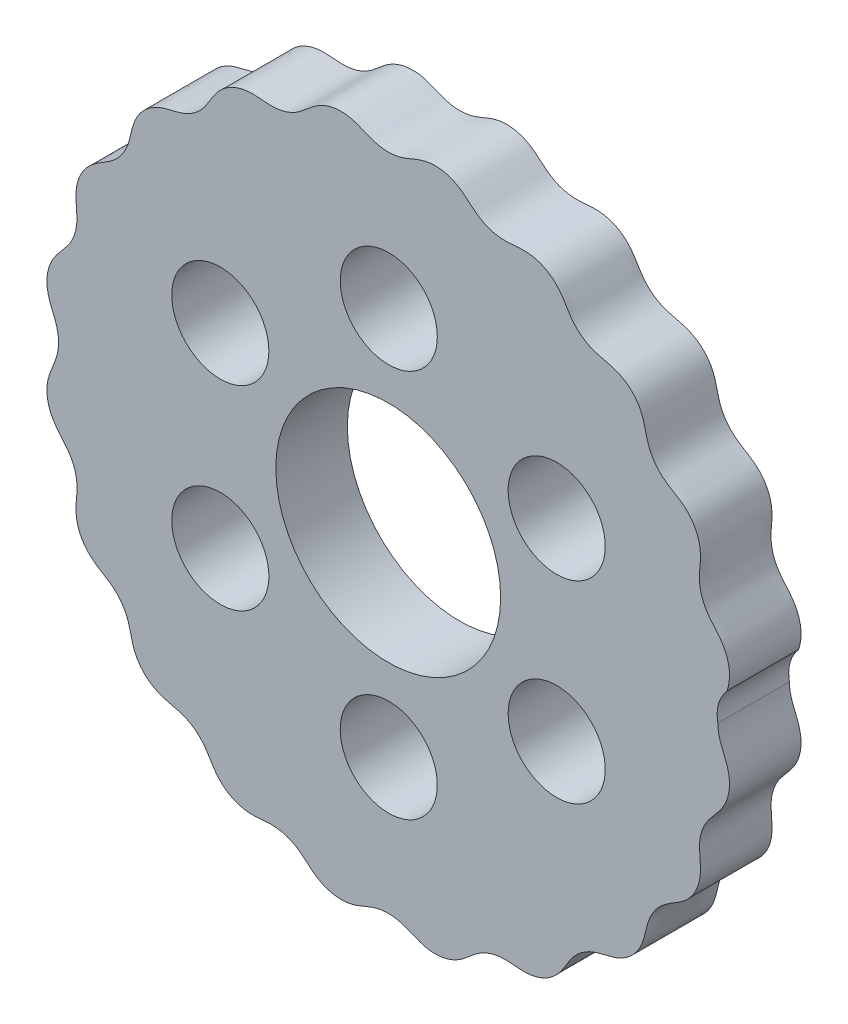
from build123d import *

# Parameters (mm, degrees)
BOSS_EXTRUDE1_DEPTH = 7
SKETCH2_R           = 11
SKETCH2_R_2         = 4.75
SKETCH2_R_3         = 4.749999995
SKETCH2_R_4         = 4.750000007
SKETCH2_R_5         = 4.750000003
CUT_EXTRUDE3_DEPTH  = 48.733141781


with BuildPart() as part:
    # Sketch1 → Boss-Extrude1 (new body)
    with BuildSketch(Plane.XY):
        with BuildLine():
            add(Edge.make_bspline(
                [(32.25, 1e-09), (32.25, -0.03584026), (32.251080395, -0.107557917), (32.255942168, -0.244822693), (32.268861596, -0.42423358), (32.288126492, -0.590307491), (32.313597344, -0.75526022), (32.345083769, -0.921284338), (32.382340363, -1.086200834), (32.435743217, -1.290221504), (32.510017409, -1.532192074), (32.609572454, -1.810337489), (32.736031435, -2.123211782), (32.868409264, -2.433561535), (32.998463612, -2.744978513), (33.147670028, -3.139574299), (33.29203351, -3.625611027), (33.391238098, -4.209938144), (33.40159236, -4.963887179), (33.263092101, -5.783976593), (32.933637021, -6.632976673), (32.380720256, -7.44914111), (31.743633074, -8.128548572), (31.194565339, -8.824864423), (30.792041933, -9.563839804), (30.542619062, -10.317563139), (30.426059081, -11.150959974), (30.453700427, -12.037430256), (30.571486472, -12.961397721), (30.548973562, -13.946062453), (30.305827306, -14.908972914), (29.8488621, -15.794930036), (29.197566297, -16.55957303), (28.387565065, -17.156146763), (27.550974388, -17.611279668), (26.8094699, -18.137433767), (26.205567855, -18.754025976), (25.754198906, -19.433148369), (25.419097837, -20.210957063), (25.205654831, -21.059332432), (25.023165763, -21.946222304), (24.678918541, -22.824303369), (24.155385031, -23.610913554), (23.47258695, -24.266165938), (22.663154471, -24.7596191), (21.767380441, -25.068988477), (20.873877723, -25.241670484), (20.026176208, -25.483558737), (19.257961529, -25.852796939), (18.597014435, -26.339289543), (18.015319336, -26.96235034), (17.530200194, -27.697909274), (17.088002691, -28.493747234), (16.507844893, -29.243486782), (15.772859754, -29.859313296), (14.912564693, -30.302576631), (13.965315475, -30.54635699), (12.98025215, -30.573037387), (12.056322353, -30.455886167), (11.169960105, -30.425170838), (10.336137669, -30.538425829), (9.581252254, -30.784420953), (8.840709776, -31.184040969), (8.142429819, -31.730755162), (7.463613048, -32.368451781), (6.650013052, -32.924567132), (5.739798426, -33.282624756), (4.783005447, -33.428033479), (3.826528798, -33.360257301), (2.916983602, -33.093242599), (2.091628303, -32.709045741), (1.26637753, -32.40011834), (0.429302587, -32.239240586), (-0.391382596, -32.235565239), (-1.22968536, -32.389684614), (-2.0572378, -32.693302158), (-2.881721983, -33.078601543), (-3.788770237, -33.353385358), (-4.733774423, -33.42838768), (-5.671092486, -33.298000902), (-6.556445254, -32.967881994), (-7.350178183, -32.458558488), (-8.018687609, -31.847917072), (-8.690679722, -31.287739131), (-9.419625653, -30.856516656), (-10.184465575, -30.573711459), (-11.03571026, -30.431180216), (-11.944792517, -30.442626541), (-12.889163565, -30.566141215), (-13.895181285, -30.557956001), (-14.87113339, -30.320567678), (-15.760797756, -29.870869827), (-16.522447913, -29.233522337), (-17.118094619, -28.449212827), (-17.565712962, -27.632421294), (-18.065390764, -26.899614077), (-18.650481966, -26.294814018), (-19.296064795, -25.832745125), (-20.056657392, -25.472681848), (-20.910331773, -25.233134263), (-21.825203321, -25.057736755), (-22.751582791, -24.720739593), (-23.573115298, -24.189933119), (-24.248840304, -23.497093196), (-24.751359701, -22.680439304), (-25.064603709, -21.786008149), (-25.237894516, -20.892406484), (-25.476928432, -20.044090314), (-25.843074795, -19.274341716), (-26.326600825, -18.611224875), (-26.947330385, -18.027030012), (-27.681412221, -17.539453985), (-28.477538309, -17.097997439), (-29.229618148, -16.521157931), (-29.848604233, -15.788832927), (-30.295754573, -14.930542362), (-30.543605502, -13.984363508), (-30.57456144, -12.999231857), (-30.458084156, -12.075098728), (-30.424367357, -11.188988864), (-30.534311318, -10.354690195), (-30.776875242, -9.598734005), (-31.173567909, -8.856576796), (-31.717880897, -8.156414765), (-32.356136698, -7.477963354), (-32.915398504, -6.667140338), (-33.283154456, -5.744604994), (-33.432509226, -4.758990118), (-33.353397152, -3.75766975), (-33.047197129, -2.799491173), (-32.637917259, -1.939569952), (-32.348479254, -1.077600722), (-32.223693767, -0.223626791), (-32.259097298, 0.591019042), (-32.446410543, 1.416966955), (-32.773243466, 2.228342112), (-33.146425069, 3.05346988), (-33.382488072, 3.966548555), (-33.420035871, 4.916249167), (-33.247541542, 5.857668601), (-32.870746257, 6.745815511), (-32.306284436, 7.533437088), (-31.679184935, 8.200013939), (-31.151082078, 8.893226913), (-30.767724626, 9.62347225), (-30.533327538, 10.364780464), (-30.425852641, 11.182587503), (-30.456115217, 12.053028073), (-30.57044759, 12.961496123), (-30.549533517, 13.930765879), (-30.315621222, 14.877939042), (-29.87541213, 15.751878255), (-29.247523253, 16.509050406), (-28.46544523, 17.108273666), (-27.648960196, 17.55636261), (-26.914470828, 18.053478276), (-26.307340893, 18.636141864), (-25.842338245, 19.279662272), (-25.479266059, 20.038804033), (-25.236815929, 20.891806711), (-25.062198676, 21.806705948), (-24.729295697, 22.734354454), (-24.20202431, 23.558169194), (-23.512255201, 24.237008277), (-22.697777389, 24.74303772), (-21.804533826, 25.060153895), (-20.910965853, 25.234161069), (-20.061987548, 25.470376036), (-19.290772545, 25.833422728), (-18.625484989, 26.313982965), (-18.0388195, 26.93231861), (-17.548735535, 27.664959335), (-17.10796282, 28.461209915), (-16.534392163, 29.215784218), (-15.812944863, 29.830728484), (-14.977234069, 30.274744494), (-14.066517637, 30.526562287), (-13.124972172, 30.579491021), (-12.225320095, 30.477855894), (-11.352300693, 30.420611213), (-10.509198984, 30.5014714), (-9.724582773, 30.723575454), (-8.952700657, 31.109863531), (-8.224799511, 31.654406363), (-7.53328827, 32.309492131), (-6.713650395, 32.892779932), (-5.778866527, 33.275025561), (-4.783689107, 33.432306412), (-3.776579779, 33.356996625), (-2.817028253, 33.054939744), (-1.956947609, 32.645597809), (-1.096221684, 32.353093368), (-0.24268098, 32.224753798), (0.572143478, 32.256517558), (1.398855976, 32.440618518), (2.211303462, 32.765181102), (3.035622993, 33.139660067), (3.947616622, 33.379700709), (4.891604445, 33.421034296), (5.823512573, 33.256381407), (6.69945148, 32.893917966), (7.477767129, 32.353045748), (8.142948467, 31.731914513), (8.835724848, 31.186903416), (9.584991508, 30.780564963), (10.366383266, 30.529626848), (11.212102964, 30.423164574), (12.092486758, 30.461281464), (12.99612118, 30.571807634), (13.943649273, 30.545643795), (14.874489725, 30.315479217), (15.739983569, 29.882441225), (16.495629409, 29.261403498), (17.098384886, 28.481668508), (17.547072979, 27.665471693), (18.041630009, 26.929367925), (18.621868133, 26.319917893), (19.263294063, 25.852011417), (20.020958736, 25.485922122), (20.873264512, 25.240541889), (21.788177848, 25.066597447), (22.717076691, 24.737783832), (23.543166874, 24.214052248), (24.225109953, 23.527364126), (24.734646511, 22.715070024), (25.0556406, 21.823032223), (25.230470514, 20.929510983), (25.463891902, 20.079894914), (25.823854301, 19.307238044), (26.301409548, 18.639811686), (26.917359159, 18.050670837), (27.648460376, 17.558076142), (28.444909927, 17.117856696), (29.201785946, 16.547605137), (29.81984157, 15.82878727), (30.267636372, 14.995097053), (30.523375754, 14.085436493), (30.580435366, 13.144017152), (30.480213655, 12.243995051), (30.420588583, 11.371383627), (30.497965021, 10.527830776), (30.716858994, 9.742562755), (31.099373189, 8.968622161), (31.567480712, 8.340299437), (32.038361194, 7.819076523), (32.437316878, 7.337829001), (32.724515784, 6.927769227), (32.967242303, 6.489680677), (33.159093214, 6.026952619), (33.298790924, 5.536156351), (33.370144453, 5.089484367), (33.392607682, 4.695978095), (33.384025491, 4.360403743), (33.360509543, 4.092595223), (33.325535309, 3.859348386), (33.287278414, 3.665828734), (33.246547966, 3.497829168), (33.208210173, 3.357605542), (33.178892757, 3.259230135), (33.161701284, 3.204461577), (33.1529127, 3.177331049)],
                knots=[0.074412945, 0.074412945, 0.074412945, 0.074412945, 0.074412945, 0.075079832, 0.075746718, 0.076413605, 0.077080492, 0.077747379, 0.078414266, 0.079081153, 0.07974804, 0.081081814, 0.082415588, 0.083749362, 0.085083135, 0.086416909, 0.087750683, 0.090418231, 0.093085778, 0.095753326, 0.099621314, 0.103489302, 0.10735729, 0.111225278, 0.114346934, 0.117468589, 0.120590245, 0.123711901, 0.127579429, 0.131446956, 0.135314483, 0.13918201, 0.143133347, 0.147084683, 0.151036019, 0.154987355, 0.158192723, 0.16139809, 0.164603458, 0.167808826, 0.171509303, 0.175209781, 0.178910259, 0.182610737, 0.186332763, 0.19005479, 0.193776816, 0.197498843, 0.200724519, 0.203950195, 0.207175871, 0.210401547, 0.214124039, 0.21784653, 0.221569022, 0.225291513, 0.229159212, 0.23302691, 0.236894609, 0.240762307, 0.243884009, 0.24700571, 0.250127411, 0.253249113, 0.257116886, 0.260984658, 0.264852431, 0.268720204, 0.272442617, 0.276165031, 0.279887444, 0.283609858, 0.286835561, 0.290061263, 0.293286965, 0.296512668, 0.300234744, 0.303956821, 0.307678897, 0.311400974, 0.31510136, 0.318801747, 0.322502134, 0.32620252, 0.329407959, 0.332613398, 0.335818836, 0.339024275, 0.342975633, 0.346926991, 0.350878349, 0.354829708, 0.358697179, 0.36256465, 0.36643212, 0.370299591, 0.373421213, 0.376542834, 0.379664455, 0.382786076, 0.386654154, 0.390522232, 0.394390309, 0.398258387, 0.401980554, 0.405702722, 0.409424889, 0.413147056, 0.416372784, 0.419598511, 0.422824238, 0.426049965, 0.429772262, 0.433494558, 0.437216855, 0.440939151, 0.444807053, 0.448674955, 0.452542858, 0.45641076, 0.459532441, 0.462654122, 0.465775803, 0.468897484, 0.472765073, 0.476632662, 0.48050025, 0.484367839, 0.48831916, 0.492270481, 0.496221802, 0.500173123, 0.503378411, 0.506583699, 0.509788987, 0.512994275, 0.516694845, 0.520395415, 0.524095986, 0.527796556, 0.531602998, 0.535409439, 0.539215881, 0.543022322, 0.546079068, 0.549135814, 0.55219256, 0.555249306, 0.559056331, 0.562863355, 0.56667038, 0.570477405, 0.574345034, 0.578212663, 0.582080292, 0.585947921, 0.589069613, 0.592191305, 0.595312997, 0.598434689, 0.60230254, 0.606170391, 0.610038243, 0.613906094, 0.617628434, 0.621350774, 0.625073114, 0.628795454, 0.632021174, 0.635246894, 0.638472615, 0.641698335, 0.645420466, 0.649142598, 0.652864729, 0.65658686, 0.660287157, 0.663987454, 0.667687751, 0.671388049, 0.67459355, 0.67779905, 0.681004551, 0.684210052, 0.688161439, 0.692112826, 0.696064213, 0.7000156, 0.703966976, 0.707918351, 0.711869726, 0.715821101, 0.719026579, 0.722232057, 0.725437535, 0.728643013, 0.732343344, 0.736043676, 0.739744007, 0.743444338, 0.747166448, 0.750888558, 0.754610667, 0.758332777, 0.761558491, 0.764784206, 0.76800992, 0.771235635, 0.774958003, 0.77868037, 0.782402738, 0.786125106, 0.789992926, 0.793860747, 0.797728568, 0.801596388, 0.804718085, 0.807839781, 0.810961478, 0.814083175, 0.81795083, 0.821818485, 0.82568614, 0.829553796, 0.833276337, 0.836998878, 0.84072142, 0.844443961, 0.847669617, 0.850895272, 0.854120928, 0.857346583, 0.861068582, 0.86479058, 0.868512578, 0.872234577, 0.875935111, 0.879635646, 0.883336181, 0.887036715, 0.890242035, 0.893447355, 0.896652674, 0.899857994, 0.90380932, 0.905784983, 0.907760646, 0.909736309, 0.911711972, 0.913687635, 0.915663298, 0.917785895, 0.918847194, 0.919908493, 0.920969792, 0.922031091, 0.92256174, 0.923092389, 0.923623039, 0.924153688, 0.924153688, 0.924153688, 0.924153688, 0.924153688], degree=4))
            add(Edge.make_bspline(
                [(33.1529127, 3.177331049), (31.922295464, 1.706002382), (32.25, 1e-09)],
                knots=[0, 0, 0, 1, 1, 1], degree=2))
        make_face()
    extrude(amount=BOSS_EXTRUDE1_DEPTH)

    # Sketch2 → Cut-Extrude3 (cut, through all)
    with BuildSketch(Plane.XY.offset(7)):
        Circle(SKETCH2_R)
        with Locations((0.054422972, 18.999922056)):
            Circle(SKETCH2_R_2)
        with Locations((16.481626656, 9.452829352)):
            Circle(SKETCH2_R_2)
        with Locations((-16.427203685, 9.547092704)):
            Circle(SKETCH2_R_2)
        with Locations((16.481626656, -9.452829352)):
            Circle(SKETCH2_R_3)
        with Locations((0.054422972, -18.999922056)):
            Circle(SKETCH2_R_4)
        with Locations((-16.427203685, -9.547092704)):
            Circle(SKETCH2_R_5)
    extrude(amount=-CUT_EXTRUDE3_DEPTH, mode=Mode.SUBTRACT)


solid = part.part
